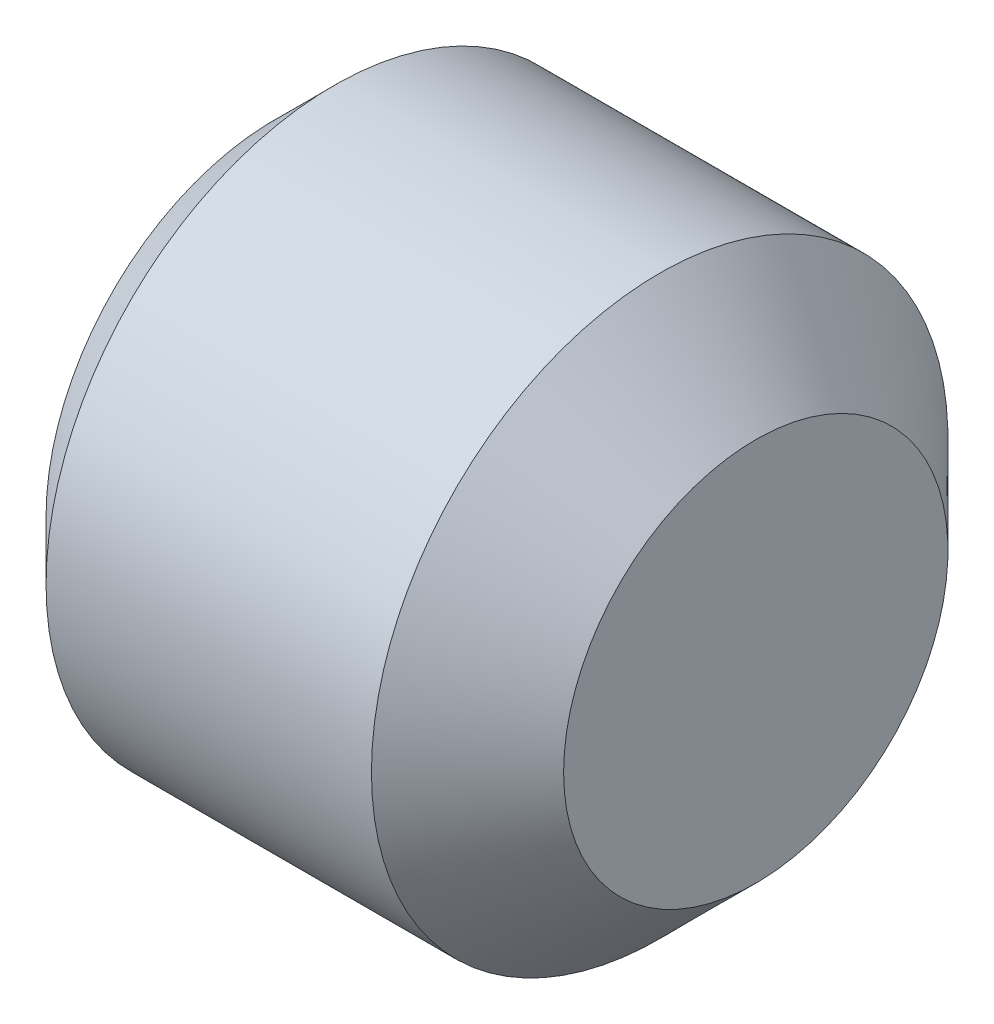
from build123d import *

# Parameters (mm, degrees)
CUT_EXTRUDE_1_DEPTH = 2


with BuildPart() as part:
    # 草图1 → 旋转1 (revolve)
    with BuildSketch(Plane.XY):
        Polygon((-5, 0), (-5, 2.3865), (-4.3865, 3), (-1, 3), (0, 2), (0, 0), align=None)
    revolve(axis=Axis((0, 0, 0), (-1, 0, 0)))

    # 草图2 → 切除-拉伸1 (cut)
    with BuildSketch(Plane.ZY.offset(5)):
        Polygon((0.866025404, -1.5), (1.732050808, 0), (0.866025404, 1.5), (-0.866025404, 1.5), (-1.732050808, 0), (-0.866025404, -1.5), align=None)
    extrude(amount=-CUT_EXTRUDE_1_DEPTH, mode=Mode.SUBTRACT)

    # 草图3 → 切除-旋转1 (revolve, cut)
    with BuildSketch(Plane.XY):
        Polygon((-3, 0), (-3, 1.5), (-2.133974596, 0), align=None)
    revolve(axis=Axis((-2.133974596, 0, 0), (-1, 0, 0)), mode=Mode.SUBTRACT)


solid = part.part
